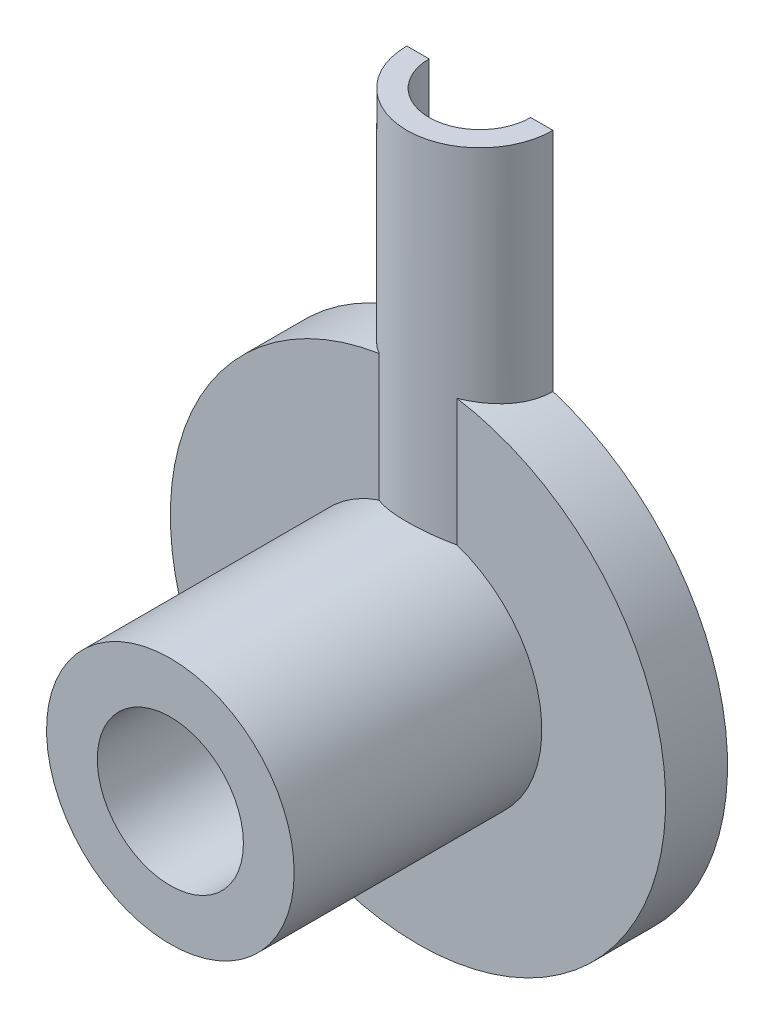
from build123d import *
from build123d.topology import SkipClean

# Parameters (mm, degrees)
SKETCH1_R           = 10
SKETCH1_R_2         = 2.95
BOSS_EXTRUDE1_DEPTH = 2.5
SKETCH2_R           = 5
SKETCH2_R_2         = 2.95
BOSS_EXTRUDE2_DEPTH = 10
SKETCH7_W           = 2.95
SKETCH7_H           = 18.687164731
REVOLVE7_ANGLE      = 180
SKETCH8_W           = 2.05
SKETCH8_H           = 18.687164731
SKETCH9_R           = 2.95
CUT_EXTRUDE1_DEPTH  = 5


with BuildPart() as part:
    # Sketch1 → Boss-Extrude1 (new body)
    with BuildSketch(Plane.XY):
        with Locations((102.341205301, 36.416113389)):
            Circle(SKETCH1_R)
        with Locations((102.341205301, 36.416113389)):
            Circle(SKETCH1_R_2, mode=Mode.SUBTRACT)
    extrude(amount=BOSS_EXTRUDE1_DEPTH)

    # Sketch2 → Boss-Extrude2 (add)
    with BuildSketch(Plane.XY.offset(2.5)):
        with Locations((102.341205301, 36.416113389)):
            Circle(SKETCH2_R)
        with Locations((102.341205301, 36.416113389)):
            Circle(SKETCH2_R_2, mode=Mode.SUBTRACT)
    extrude(amount=BOSS_EXTRUDE2_DEPTH)

    # Sketch7 → Revolve7 (revolve)
    with BuildSketch(Plane(origin=(0, 0, 0), x_dir=(-1, 0, 0), z_dir=(0, 0, -1))):
        with Locations((-103.816205301, 45.759695755)):
            Rectangle(SKETCH7_W, SKETCH7_H)
    revolve(axis=Axis((102.341205301, 36.416113389, 0), (0, -1, 0)), revolution_arc=REVOLVE7_ANGLE)

    # Sketch8 → Cut-Revolve2 (revolve, cut)
    with BuildSketch(Plane(origin=(0, 0, 0), x_dir=(-1, 0, 0), z_dir=(0, 0, -1))):
        with Locations((-103.366205301, 45.759695755)):
            Rectangle(SKETCH8_W, SKETCH8_H)
    revolve(axis=Axis((102.341205301, 36.416113389, 0), (0, 1, 0)), mode=Mode.SUBTRACT)

    # Sketch9 → Cut-Extrude1 (cut)
    with SkipClean():  # the faces are left unmerged after this step: merging them gives an invalid solid
        with BuildSketch(Plane(origin=(0, 0, 0), x_dir=(-1, 0, 0), z_dir=(0, 0, -1))):
            with Locations((-102.341205301, 36.416113389)):
                Circle(SKETCH9_R)
        extrude(amount=-CUT_EXTRUDE1_DEPTH, mode=Mode.SUBTRACT)


solid = part.part
